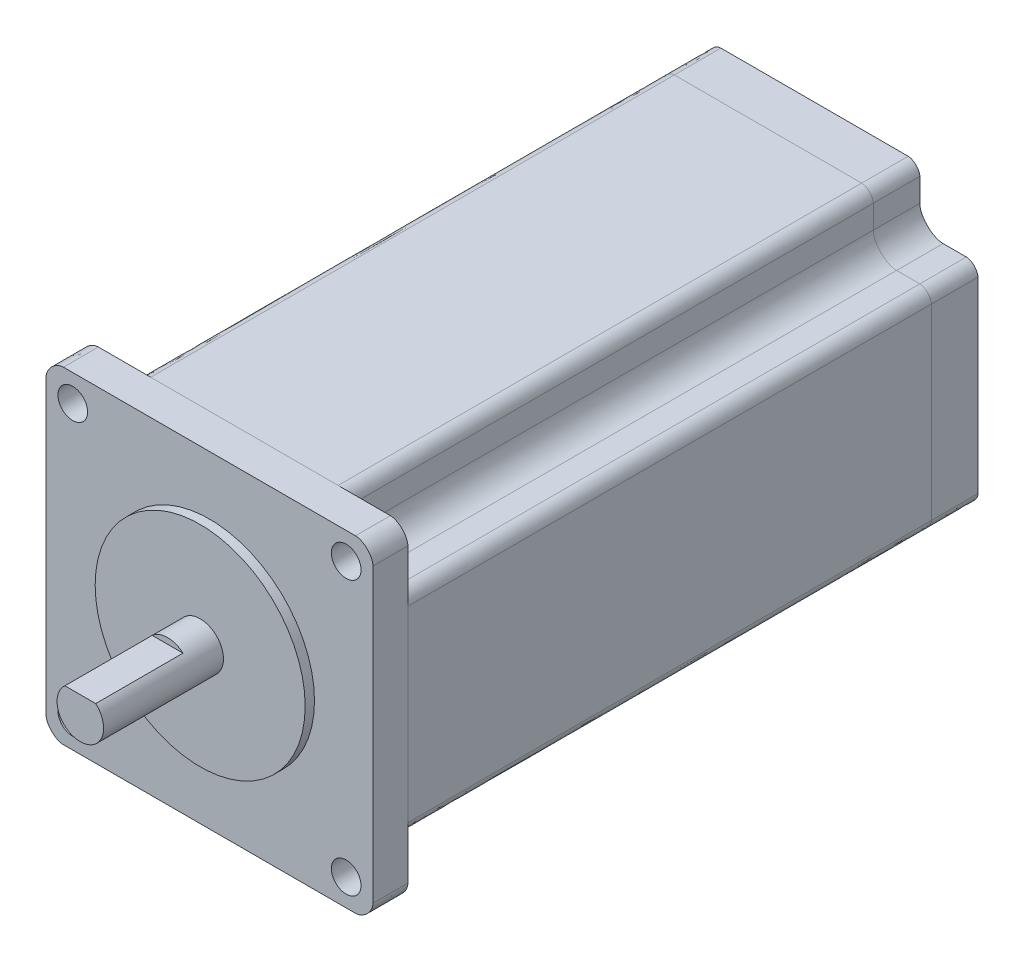
from build123d import *

# Parameters (mm, degrees)
ESQUISSE1_W             = 56.2
ESQUISSE1_H             = 56.2
BOSS_EXTRU_1_DEPTH      = 104
ESQUISSE2_R             = 18.05
BOSS_EXTRU_2_DEPTH      = 1.6
ESQUISSE3_R             = 4
BOSS_EXTRU_3_DEPTH      = 20.6
ESQUISSE4_W             = 11.556129306
ESQUISSE4_H             = 4.943084212
ENL_V_MAT_EXTRU_1_DEPTH = 15
ESQUISSE6_W             = 10
ESQUISSE6_H             = 10
ENL_V_MAT_EXTRU_2_DEPTH = 98
CONG_1_SIZE             = 4
CONG_2_SIZE             = 2
ESQUISSE5_R             = 2.55
ENL_V_MAT_EXTRU_3_DEPTH = 112.333822498
CONG_3_SIZE             = 3


with BuildPart() as part:
    # Esquisse1 → Boss.-Extru.1 (new body)
    with BuildSketch(Plane.XY):
        Rectangle(ESQUISSE1_W, ESQUISSE1_H)
    extrude(amount=BOSS_EXTRU_1_DEPTH)

    # Esquisse2 → Boss.-Extru.2 (add)
    with BuildSketch(Plane.XY.offset(104)):
        Circle(ESQUISSE2_R)
    extrude(amount=BOSS_EXTRU_2_DEPTH)

    # Esquisse3 → Boss.-Extru.3 (add)
    with BuildSketch(Plane.XY.offset(105.6)):
        with Locations(Location((0, 0, 0), (0, 0, 180))):
            Circle(ESQUISSE3_R)
    extrude(amount=BOSS_EXTRU_3_DEPTH)

    # Esquisse4 → Enlèv. mat.-Extru.1 (cut)
    with BuildSketch(Plane.XY.offset(126.2)):
        with Locations((0, 5.471542106)):
            Rectangle(ESQUISSE4_W, ESQUISSE4_H)
    extrude(amount=-ENL_V_MAT_EXTRU_1_DEPTH, mode=Mode.SUBTRACT)

    # Esquisse6 → Enlèv. mat.-Extru.2 (cut)
    with BuildSketch(Plane(origin=(0, 0, 0), x_dir=(-1, 0, 0), z_dir=(0, 0, -1))):
        with Locations((-23.1, 23.1)):
            Rectangle(ESQUISSE6_W, ESQUISSE6_H)
        with Locations((23.1, 23.1)):
            Rectangle(ESQUISSE6_W, ESQUISSE6_H)
        with Locations((23.1, -23.1)):
            Rectangle(ESQUISSE6_W, ESQUISSE6_H)
        with Locations((-23.1, -23.1)):
            Rectangle(ESQUISSE6_W, ESQUISSE6_H)
    extrude(amount=-ENL_V_MAT_EXTRU_2_DEPTH, mode=Mode.SUBTRACT)

    # Congé1
    # a fillet whose section is not a circle: 4 mm, written as the material it adds along each edge
    with BuildSketch(Plane(origin=(18.1, -18.1, 0), x_dir=(1, 0, 0), z_dir=(0, 0, 1)), Plane(origin=(-18.1, -18.1, 0), x_dir=(0, -1, 0), z_dir=(0, 0, 1))) as cong_1_piece_1:
        with BuildLine():
            Bezier((CONG_1_SIZE, 0), (0, 0), (0, -CONG_1_SIZE), weights=[1, 0.538461538, 1])
            Line((0, -CONG_1_SIZE), (0, 0))
            Line((0, 0), (CONG_1_SIZE, 0))
        make_face()
    extrude(amount=98)
    with BuildSketch(Plane(origin=(-18.1, 18.1, 0), x_dir=(0, 1, 0), z_dir=(0, 0, 1))) as cong_1_piece_2_section:
        with BuildLine():
            Bezier((CONG_1_SIZE, 0), (0, 0), (0, CONG_1_SIZE), weights=[1, 0.538461538, 1])
            Line((0, CONG_1_SIZE), (0, 0))
            Line((0, 0), (CONG_1_SIZE, 0))
        make_face()
    cong_1_piece_2 = extrude(amount=108, mode=Mode.PRIVATE)
    cong_1_piece_2 = split(cong_1_piece_2, bisect_by=Plane(origin=(-18.1, 18.1, 104), z_dir=(0, 0, -1)), keep=Keep.TOP, mode=Mode.PRIVATE)
    add(cong_1_piece_2)
    with BuildSketch(Plane(origin=(18.1, 18.1, 0), x_dir=(0, 1, 0), z_dir=(0, 0, 1))) as cong_1_piece_3_section:
        with BuildLine():
            Bezier((CONG_1_SIZE, 0), (0, 0), (0, -CONG_1_SIZE), weights=[1, 0.538461538, 1])
            Line((0, -CONG_1_SIZE), (0, 0))
            Line((0, 0), (CONG_1_SIZE, 0))
        make_face()
    cong_1_piece_3 = extrude(amount=108, mode=Mode.PRIVATE)
    cong_1_piece_3 = split(cong_1_piece_3, bisect_by=Plane(origin=(18.1, 18.1, 104), z_dir=(0, 0, -1)), keep=Keep.TOP, mode=Mode.PRIVATE)
    add(cong_1_piece_3)

    # Congé2
    # a fillet whose section is not a circle: 2 mm, written as the material it takes off along each edge
    with BuildSketch(Plane(origin=(18.1, 28.1, -5), x_dir=(0, -1, 0), z_dir=(0, 0, 1)), Plane(origin=(18.1, -28.1, -5), x_dir=(-1, 0, 0), z_dir=(0, 0, 1)), Plane(origin=(-18.1, 28.1, -5), x_dir=(1, 0, 0), z_dir=(0, 0, 1)), Plane(origin=(-28.1, 18.1, -5), x_dir=(1, 0, 0), z_dir=(0, 0, 1)), Plane(origin=(-28.1, -18.1, -5), x_dir=(0, 1, 0), z_dir=(0, 0, 1)), Plane(origin=(-18.1, -28.1, -5), x_dir=(0, 1, 0), z_dir=(0, 0, 1))) as cong_2_piece_1:
        with BuildLine():
            Bezier((CONG_2_SIZE, 0), (0, 0), (0, -CONG_2_SIZE), weights=[1, 0.538461538, 1])
            Line((0, -CONG_2_SIZE), (0, 0))
            Line((0, 0), (CONG_2_SIZE, 0))
        make_face()
    extrude(amount=103, mode=Mode.SUBTRACT)
    with BuildSketch(Plane(origin=(28.1, 18.1, -5), x_dir=(-1, 0, 0), z_dir=(0, 0, 1)), Plane(origin=(28.1, -18.1, -5), x_dir=(0, 1, 0), z_dir=(0, 0, 1))) as cong_2_piece_2:
        with BuildLine():
            Bezier((CONG_2_SIZE, 0), (0, 0), (0, CONG_2_SIZE), weights=[1, 0.538461538, 1])
            Line((0, CONG_2_SIZE), (0, 0))
            Line((0, 0), (CONG_2_SIZE, 0))
        make_face()
    extrude(amount=103, mode=Mode.SUBTRACT)

    # Esquisse5 → Enlèv. mat.-Extru.3 (cut, through all)
    with BuildSketch(Plane.XY.offset(104)):
        with Locations((-23.5, 23.5)):
            Circle(ESQUISSE5_R)
        with Locations((23.5, 23.5)):
            Circle(ESQUISSE5_R)
        with Locations((23.5, -23.5)):
            Circle(ESQUISSE5_R)
        with Locations((-23.5, -23.5)):
            Circle(ESQUISSE5_R)
    extrude(amount=-ENL_V_MAT_EXTRU_3_DEPTH, mode=Mode.SUBTRACT)

    # Congé3
    # a fillet whose section is not a circle: 3 mm, written as the material it takes off along each edge
    with BuildSketch(Plane(origin=(-28.1, 28.1, 90.5), x_dir=(1, 0, 0), z_dir=(0, 0, 1)), Plane(origin=(-28.1, -28.1, 90.5), x_dir=(0, 1, 0), z_dir=(0, 0, 1)), Plane(origin=(28.1, -28.1, 90.5), x_dir=(-1, 0, 0), z_dir=(0, 0, 1))) as cong_3_piece_1:
        with BuildLine():
            Bezier((CONG_3_SIZE, 0), (0, 0), (0, -CONG_3_SIZE), weights=[1, 0.538461538, 1])
            Line((0, -CONG_3_SIZE), (0, 0))
            Line((0, 0), (CONG_3_SIZE, 0))
        make_face()
    extrude(amount=21, mode=Mode.SUBTRACT)
    with BuildSketch(Plane(origin=(28.1, 28.1, 90.5), x_dir=(-1, 0, 0), z_dir=(0, 0, 1))) as cong_3_piece_2:
        with BuildLine():
            Bezier((CONG_3_SIZE, 0), (0, 0), (0, CONG_3_SIZE), weights=[1, 0.538461538, 1])
            Line((0, CONG_3_SIZE), (0, 0))
            Line((0, 0), (CONG_3_SIZE, 0))
        make_face()
    extrude(amount=21, mode=Mode.SUBTRACT)


with BuildPart() as body_2:
    # Intersect1: read off the stored shape, not the designer's step
    # Intersect1: the piece on the far side of the plane
    add(part.part)
    split(bisect_by=Plane.XY.offset(98), keep=Keep.BOTTOM)


with BuildPart() as part_1:
    add(part.part)

    # Intersect1
    split(bisect_by=Plane.XY.offset(98), keep=Keep.TOP)


with BuildPart() as body_3:
    # Intersect2: read off the stored shape, not the designer's step
    # Intersect2: the piece on the far side of the plane
    add(body_2.part)
    split(bisect_by=Plane.XY.offset(8), keep=Keep.BOTTOM)


with BuildPart() as body_2_1:
    add(body_2.part)

    # Intersect2
    split(bisect_by=Plane.XY.offset(8), keep=Keep.TOP)


solid = Compound([part_1.part, body_3.part, body_2_1.part])
